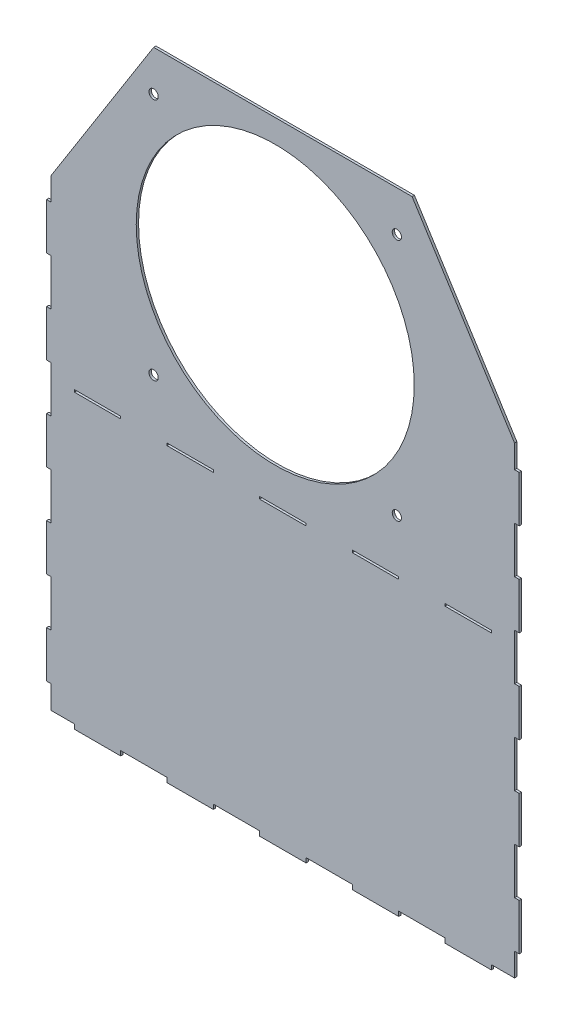
from build123d import *

# Parameters (mm, degrees)
SKICA1_W                = 20
SKICA1_H                = 1
SKICA1_R                = 2
SKICA1_R_2              = 60
P_IDAT_VYSUNUT_M1_DEPTH = 1


with BuildPart() as part:
    # Skica1 → Přidat vysunutím1 (new body)
    with BuildSketch(Plane.XY):
        Polygon((-124.598141023, -103.240049383), (-124.598141023, -113.240049383), (-114.598141023, -113.240049383), (-114.598141023, -115.240049383), (-94.598141023, -115.240049383), (-94.598141023, -113.240049383), (-74.598141023, -113.240049383), (-74.598141023, -115.240049383), (-54.598141023, -115.240049383), (-54.598141023, -113.240049383), (-34.598141023, -113.240049383), (-34.598141023, -115.240049383), (-14.598141023, -115.240049383), (-14.598141023, -113.240049383), (5.401858977, -113.240049383), (5.401858977, -115.240049383), (25.401858977, -115.240049383), (25.401858977, -113.240049383), (45.401858977, -113.240049383), (45.401858977, -115.240049383), (65.401858977, -115.240049383), (65.401858977, -113.240049383), (75.401858977, -113.240049383), (75.401858977, -103.240049383), (77.401858977, -103.240049383), (77.401858977, -83.240049383), (75.401858977, -83.240049383), (75.401858977, -63.240049383), (77.401858977, -63.240049383), (77.401858977, -43.240049383), (75.401858977, -43.240049383), (75.401858977, -23.240049383), (77.401858977, -23.240049383), (77.401858977, -3.240049383), (75.401858977, -3.240049383), (75.401858977, 16.759950617), (77.401858977, 16.759950617), (77.401858977, 36.759950617), (75.401858977, 36.759950617), (75.401858977, 56.759950617), (77.401858977, 56.759950617), (77.401858977, 76.759950617), (75.401858977, 76.759950617), (75.401858977, 86.759950617), (31.183586154, 156.759950617), (-80.379868199, 156.759950617), (-124.598141023, 86.759950617), (-124.598141023, 76.759950617), (-126.598141023, 76.759950617), (-126.598141023, 56.759950617), (-124.598141023, 56.759950617), (-124.598141023, 36.759950617), (-126.598141023, 36.759950617), (-126.598141023, 16.759950617), (-124.598141023, 16.759950617), (-124.598141023, -3.240049383), (-126.598141023, -3.240049383), (-126.598141023, -23.240049383), (-124.598141023, -23.240049383), (-124.598141023, -43.240049383), (-126.598141023, -43.240049383), (-126.598141023, -63.240049383), (-124.598141023, -63.240049383), (-124.598141023, -83.240049383), (-126.598141023, -83.240049383), (-126.598141023, -103.240049383), align=None)
        with Locations((-104.598141023, 11.259950617)):
            Rectangle(SKICA1_W, SKICA1_H, mode=Mode.SUBTRACT)
        with Locations((-64.598141023, 11.259950617)):
            Rectangle(SKICA1_W, SKICA1_H, mode=Mode.SUBTRACT)
        with Locations((-24.598141023, 11.259950617)):
            Rectangle(SKICA1_W, SKICA1_H, mode=Mode.SUBTRACT)
        with Locations((15.401858977, 11.259950617)):
            Rectangle(SKICA1_W, SKICA1_H, mode=Mode.SUBTRACT)
        with Locations((55.401858977, 11.259950617)):
            Rectangle(SKICA1_W, SKICA1_H, mode=Mode.SUBTRACT)
        with Locations((-80.379868199, 34.259950617)):
            Circle(SKICA1_R, mode=Mode.SUBTRACT)
        with Locations((-27.879868199, 86.759950617)):
            Circle(SKICA1_R_2, mode=Mode.SUBTRACT)
        with Locations((-80.379868199, 139.259950617)):
            Circle(SKICA1_R, mode=Mode.SUBTRACT)
        with Locations((24.620131801, 34.259950617)):
            Circle(SKICA1_R, mode=Mode.SUBTRACT)
        with Locations((24.620131801, 139.259950617)):
            Circle(SKICA1_R, mode=Mode.SUBTRACT)
    extrude(amount=P_IDAT_VYSUNUT_M1_DEPTH)


solid = part.part
